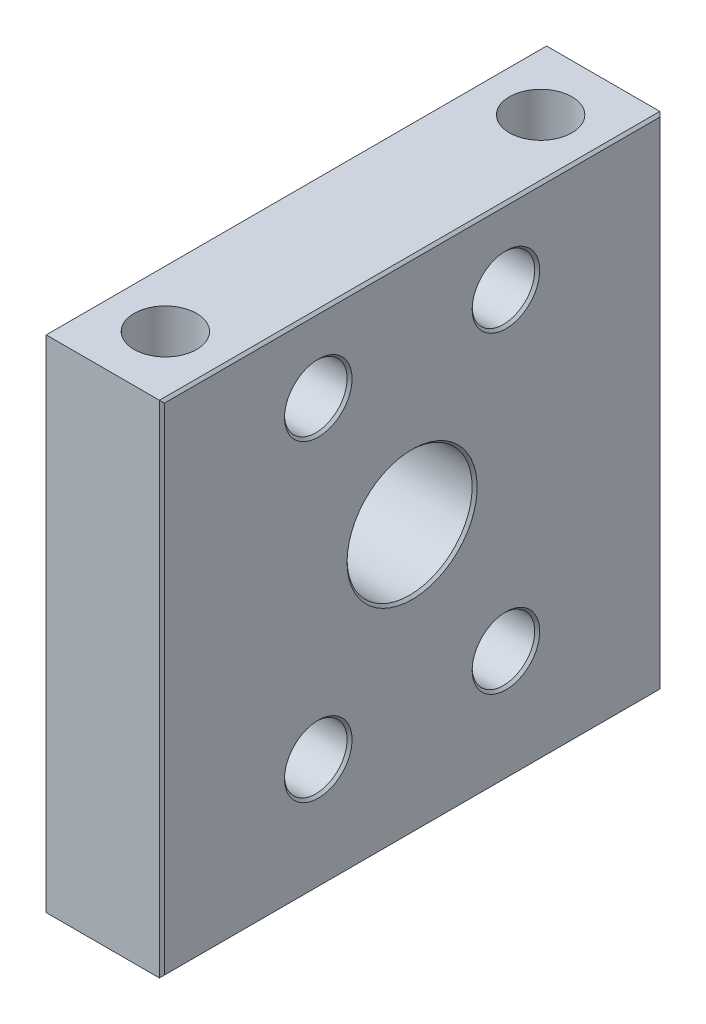
from build123d import *

# Parameters (mm, degrees)
SKETCH1_W           = 12.001902846
SKETCH1_H           = 50.8
SKETCH1_R           = 3.175
BOSS_EXTRUDE1_DEPTH = 50.8
SKETCH2_R           = 3.175
SKETCH2_R_2         = 6.35
CUT_EXTRUDE1_DEPTH  = 50.8
CHAMFER1_SIZE       = 0.254


with BuildPart() as part:
    # Sketch1 → Boss-Extrude1 (new body)
    with BuildSketch(Plane(origin=(0, 0, 0), x_dir=(1, 0, 0), z_dir=(0, 1, 0))):
        Rectangle(SKETCH1_W, SKETCH1_H)
        with Locations((0, 19.05)):
            Circle(SKETCH1_R, mode=Mode.SUBTRACT)
        with Locations((0, -19.05)):
            Circle(SKETCH1_R, mode=Mode.SUBTRACT)
    extrude(amount=BOSS_EXTRUDE1_DEPTH)

    # Sketch2 → Cut-Extrude1 (cut)
    with BuildSketch(Plane(origin=(6.000951423, 0, 0), x_dir=(0, 0, -1), z_dir=(1, 0, 0))):
        with Locations((-9.525, 43.18)):
            Circle(SKETCH2_R)
        with Locations((9.525, 43.18)):
            Circle(SKETCH2_R)
        with Locations((0, 27.305)):
            Circle(SKETCH2_R_2)
        with Locations((-9.525, 11.43)):
            Circle(SKETCH2_R)
        with Locations((9.525, 11.43)):
            Circle(SKETCH2_R)
    extrude(amount=-CUT_EXTRUDE1_DEPTH, mode=Mode.SUBTRACT)

    # Chamfer1
    chamfer1_edges = [part.edges().sort_by_distance(p)[0] for p in [
        (-6.000951423, 25.4, -25.4),
        (-6.000951423, 50.8, 0),
        (-6.000951423, 25.4, 25.4),
        (-6.000951423, 0, 0),
        (-6.000951423, 43.18, 12.7),
        (-6.000951423, 43.18, -6.35),
        (-6.000951423, 27.305, 6.35),
        (-6.000951423, 11.43, 12.7),
        (-6.000951423, 11.43, -6.35),
        (6.000951423, 25.4, 25.4),
        (6.000951423, 50.8, 0),
        (6.000951423, 25.4, -25.4),
        (6.000951423, 0, 0),
        (6.000951423, 43.18, 12.7),
        (6.000951423, 43.18, -6.35),
        (6.000951423, 27.305, 6.35),
        (6.000951423, 11.43, 12.7),
        (6.000951423, 11.43, -6.35),
    ]]
    chamfer(chamfer1_edges, length=CHAMFER1_SIZE)


solid = part.part
